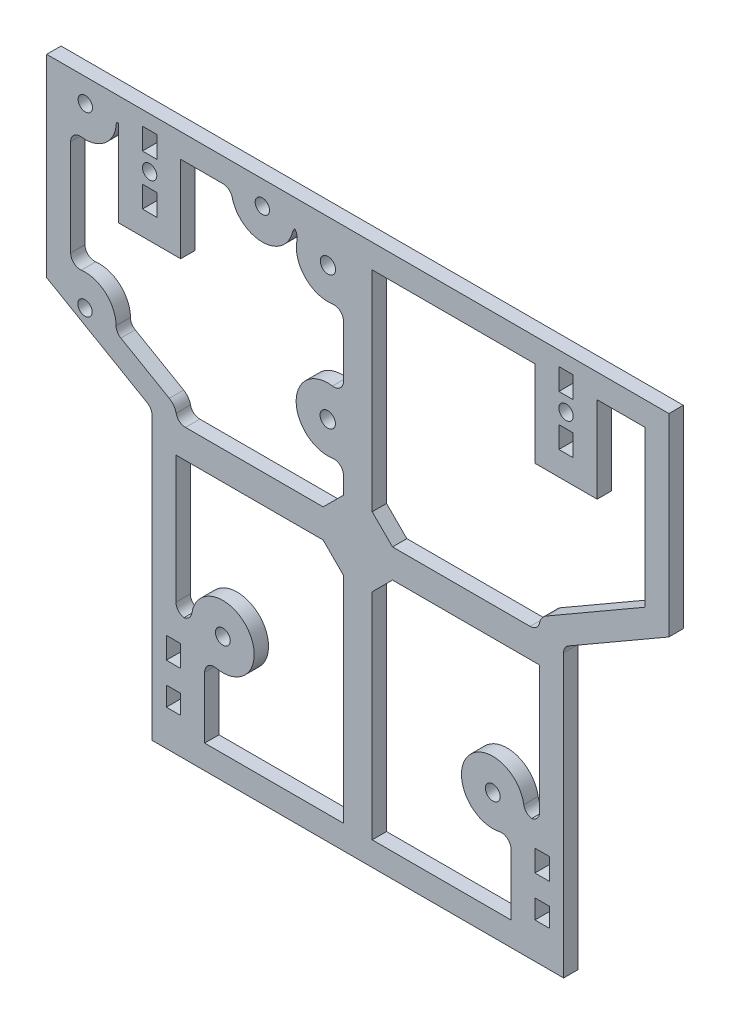
from build123d import *

# Parameters (mm, degrees)
CROQUIS1_W                 = 130
CROQUIS1_H                 = 113.129079584
CROQUIS1_W_2               = 3
CROQUIS1_H_2               = 1.5
CROQUIS1_H_3               = 4.5
SALIENTE_EXTRUIR1_DEPTH    = 3
CORTAR_EXTRUIR1_DEPTH      = 3
CROQUIS7_R                 = 1.55
CROQUIS7_R_2               = 1.6
CROQUIS7_R_3               = 1.5
CORTAR_EXTRUIR3_DEPTH      = 10
CORTAR_EXTRUIR4_DEPTH      = 10
CROQUIS9_W                 = 3
CROQUIS9_H                 = 4
CORTAR_EXTRUIR5_DEPTH      = 10
CORTAR_EXTRUIR6_DEPTH      = 87.58316764
CORTAR_EXTRUIR6_DEPTH_BACK = 87.58316764
CROQUIS10_R                = 1.5
REDONDEO1_R                = 2
REDONDEO2_R                = 3


with BuildPart() as part:
    # Croquis1 → Saliente-Extruir1 (new body)
    with BuildSketch(Plane.XY):
        with Locations((0, -0.555027071)):
            Rectangle(CROQUIS1_W, CROQUIS1_H)
        with Locations((38.5, -46.369566863)):
            Rectangle(CROQUIS1_W_2, CROQUIS1_H_2, mode=Mode.SUBTRACT)
        with Locations((-38.5, -46.369566863)):
            Rectangle(CROQUIS1_W_2, CROQUIS1_H_2, mode=Mode.SUBTRACT)
        with Locations((38.5, -38.869566863)):
            Rectangle(CROQUIS1_W_2, CROQUIS1_H_3, mode=Mode.SUBTRACT)
        with Locations((-38.5, -38.869566863)):
            Rectangle(CROQUIS1_W_2, CROQUIS1_H_3, mode=Mode.SUBTRACT)
        with Locations((43.5, 40.259512721)):
            Rectangle(CROQUIS1_W_2, CROQUIS1_H_3, mode=Mode.SUBTRACT)
        with Locations((43.5, 50.759512721)):
            Rectangle(CROQUIS1_W_2, CROQUIS1_H_3, mode=Mode.SUBTRACT)
        with Locations((-43.5, 40.259512721)):
            Rectangle(CROQUIS1_W_2, CROQUIS1_H_3, mode=Mode.SUBTRACT)
        with Locations((-43.5, 50.759512721)):
            Rectangle(CROQUIS1_W_2, CROQUIS1_H_3, mode=Mode.SUBTRACT)
    extrude(amount=SALIENTE_EXTRUIR1_DEPTH)

    # Croquis2 → Cortar-Extruir1 (cut)
    with BuildSketch(Plane.XY):
        Polygon((-43, -57.119566863), (-43, 2.880433137), (-65, 15.582139059), (-65, -57.119566863), align=None)
    cortar_extruir1 = extrude(amount=CORTAR_EXTRUIR1_DEPTH, mode=Mode.SUBTRACT)

    # Simetría1: Cortar-Extruir1 across plane
    add(cortar_extruir1.mirror(Plane(origin=(0, 0, 0), x_dir=(0, 0, 1), z_dir=(1, 0, 0))), mode=Mode.SUBTRACT)

    # Croquis7 → Cortar-Extruir3 (cut)
    with BuildSketch(Plane.XY):
        with Locations((-28.2, -30.943433351)):
            Circle(CROQUIS7_R)
        with Locations((28.2, -30.943433351)):
            Circle(CROQUIS7_R)
        with Locations((-6.242176561, 47.210601794)):
            Circle(CROQUIS7_R_2)
        with Locations((-6.287991701, 19.310639411)):
            Circle(CROQUIS7_R_2)
        with Locations((-57.003272906, 14.118912973)):
            Circle(CROQUIS7_R_3)
        with Locations((-19.942564364, 51.058104658)):
            Circle(CROQUIS7_R_3)
        with Locations((-56.942514477, 51.118863087)):
            Circle(CROQUIS7_R_3)
    extrude(amount=CORTAR_EXTRUIR3_DEPTH, mode=Mode.SUBTRACT)

    # Croquis8 → Cortar-Extruir4 (cut)
    with BuildSketch(Plane.XY):
        Polygon((37, 33.009512721), (37, 51.009512721), (3, 51.009512721), (3, 7.242640687), (7.242640687, 3), (38, 3), (38, 5.767184483), (60, 18.468890405), (60, 51.009512721), (50, 51.009512721), (50, 33.009512721), align=None)
        with BuildLine():
            Line((-7.242640687, 3), (-3, 7.242640687))
            Line((-3, 7.242640687), (-3, 13.58795555))
            ThreePointArc((-3, 13.58795555), (-12.887991701, 19.310639411), (-3, 25.033323272))
            Line((-3, 25.033323272), (-3, 41.461837479))
            ThreePointArc((-3, 41.461837479), (-11.136091988, 42.782329919), (-11.639238333, 51.009512721))
            Line((-11.639238333, 51.009512721), (-13.442745995, 51.009512721))
            ThreePointArc((-13.442745995, 51.009512721), (-19.942564364, 44.558104658), (-26.442382732, 51.009512721))
            Line((-26.442382732, 51.009512721), (-37, 51.009512721))
            Line((-37, 51.009512721), (-37, 33.009512721))
            Line((-37, 33.009512721), (-50, 33.009512721))
            Line((-50, 33.009512721), (-50, 51.009512721))
            Line((-50, 51.009512721), (-50.44343435, 51.009512721))
            ThreePointArc((-50.44343435, 51.009512721), (-53.644642278, 45.517609749), (-60, 45.382855566))
            Line((-60, 45.382855566), (-60, 19.886895872))
            ThreePointArc((-60, 19.886895872), (-53.177308637, 19.373624897), (-50.59374625, 13.03818727))
            Line((-50.59374625, 13.03818727), (-38, 5.767184483))
            Line((-38, 5.767184483), (-38, 3))
            Line((-38, 3), (-7.242640687, 3))
        make_face()
        with BuildLine():
            Line((38, -3), (7.242640687, -3))
            Line((7.242640687, -3), (3, -7.242640687))
            Line((3, -7.242640687), (3, -52.119566863))
            Line((3, -52.119566863), (32, -52.119566863))
            Line((32, -52.119566863), (32, -36.278459124))
            ThreePointArc((32, -36.278459124), (22.540832887, -27.64550558), (34.715009092, -31.619566863))
            Line((34.715009092, -31.619566863), (38, -31.619566863))
            Line((38, -31.619566863), (38, -3))
        make_face()
        with BuildLine():
            Line((-3, -7.242640687), (-7.242640687, -3))
            Line((-7.242640687, -3), (-38, -3))
            Line((-38, -3), (-38, -31.619566863))
            Line((-38, -31.619566863), (-34.715009092, -31.619566863))
            ThreePointArc((-34.715009092, -31.619566863), (-22.540832887, -27.64550558), (-32, -36.278459124))
            Line((-32, -36.278459124), (-32, -52.119566863))
            Line((-32, -52.119566863), (-3, -52.119566863))
            Line((-3, -52.119566863), (-3, -7.242640687))
        make_face()
    extrude(amount=CORTAR_EXTRUIR4_DEPTH, mode=Mode.SUBTRACT)

    # Croquis9 → Cortar-Extruir5 (cut)
    with BuildSketch(Plane.XY):
        with Locations((-38.5, -47.619566863)):
            Rectangle(CROQUIS9_W, CROQUIS9_H)
        with Locations((38.5, -47.619566863)):
            Rectangle(CROQUIS9_W, CROQUIS9_H)
    extrude(amount=CORTAR_EXTRUIR5_DEPTH, mode=Mode.SUBTRACT)

    # Croquis10 → Cortar-Extruir6 (cut, two sides: drawn at the far end of the back side and taken through both)
    with BuildSketch(Plane.XY.offset(-CORTAR_EXTRUIR6_DEPTH_BACK)):
        with Locations((43.5, 45.509512721)):
            Circle(CROQUIS10_R)
        with Locations((-43.5, 45.509512721)):
            Circle(CROQUIS10_R)
    extrude(amount=CORTAR_EXTRUIR6_DEPTH + CORTAR_EXTRUIR6_DEPTH_BACK, mode=Mode.SUBTRACT)

    # Redondeo1
    # the kernel refuses this fillet: 2 mm, written as the material it adds along each edge
    with BuildSketch(Plane(origin=(32, -36.278459124, 0), x_dir=(-0.9149086715466047, -0.40366090066889926, 0), z_dir=(0, 0, 1))) as redondeo1_piece_1:
        with BuildLine():
            CenterArc((3.050226842, 1.95877031), REDONDEO1_R, 156.192760529, 102.153197469)
            Line((1.220409498, 2.766092111), (0, 0))
            ThreePointArc((0, 0), (1.323111643, 0.135027235), (2.646223286, 0))
        make_face()
    extrude(amount=3)
    with BuildSketch(Plane(origin=(38, -31.619566863, 0), x_dir=(-1, 0, 0), z_dir=(0, 0, 1)), Plane(origin=(-38, -31.619566863, 0), x_dir=(0, 1, 0), z_dir=(0, 0, 1)), Plane(origin=(-38, 3, 0), x_dir=(0, 1, 0), z_dir=(0, 0, 1))) as redondeo1_piece_2:
        with BuildLine():
            CenterArc((REDONDEO1_R, -REDONDEO1_R), REDONDEO1_R, 90, 90)
            Line((0, -REDONDEO1_R), (0, 0))
            Line((0, 0), (REDONDEO1_R, 0))
        make_face()
    extrude(amount=3)
    with BuildSketch(Plane(origin=(34.715009092, -31.619566863, 0), x_dir=(-0.02602354238357217, 0.999661330272313, 0), z_dir=(0, 0, 1))) as redondeo1_piece_3:
        with BuildLine():
            CenterArc((1.949048389, -1.983269394), REDONDEO1_R, 97.416204182, 81.092588325)
            Line((-0.050274272, -1.93122231), (0, 0))
            ThreePointArc((0, 0), (0.845448142, -0.054792733), (1.690896284, 0))
        make_face()
    extrude(amount=3)
    with BuildSketch(Plane(origin=(-32, -36.278459124, 0), x_dir=(0, -1, 0), z_dir=(0, 0, 1))) as redondeo1_piece_4:
        with BuildLine():
            CenterArc((3.023353256, 2), REDONDEO1_R, 167.846802531, 102.153197469)
            ThreePointArc((1.068176875, 2.421052632), (0.657626025, 1.156021101), (0, 0))
            Line((0, 0), (3.023353256, 0))
        make_face()
    extrude(amount=3)
    with BuildSketch(Plane(origin=(-34.715009092, -31.619566863, 0), x_dir=(0.026023542383658504, 0.9996613302723107, 0), z_dir=(0, 0, 1))) as redondeo1_piece_5:
        with BuildLine():
            CenterArc((1.949048389, 1.983269394), REDONDEO1_R, 181.491207493, 81.092588325)
            Line((-0.050274272, 1.93122231), (0, 0))
            ThreePointArc((0, 0), (0.845448142, 0.054792733), (1.690896284, 0))
        make_face()
    extrude(amount=3)
    with BuildSketch(Plane(origin=(-43, 2.880433137, 0), x_dir=(-0.866025403784439, 0.49999999999999933, 0), z_dir=(0, 0, 1))) as redondeo1_piece_6:
        with BuildLine():
            CenterArc((REDONDEO1_R * 0.57735026919, REDONDEO1_R), REDONDEO1_R, 210, 60)
            Line((-REDONDEO1_R * 0.288675134595, REDONDEO1_R * 0.5), (0, 0))
            Line((0, 0), (REDONDEO1_R * 0.57735026919, 0))
        make_face()
    extrude(amount=3)
    with BuildSketch(Plane(origin=(43, 2.880433137, 0), x_dir=(0.866025403784439, 0.49999999999999933, 0), z_dir=(0, 0, 1))) as redondeo1_piece_7:
        with BuildLine():
            CenterArc((REDONDEO1_R * 0.57735026919, -REDONDEO1_R), REDONDEO1_R, 90, 60)
            Line((-REDONDEO1_R * 0.288675134595, -REDONDEO1_R * 0.5), (0, 0))
            Line((0, 0), (REDONDEO1_R * 0.57735026919, 0))
        make_face()
    extrude(amount=3)
    with BuildSketch(Plane(origin=(38, 3, 0), x_dir=(0, 1, 0), z_dir=(0, 0, 1))) as redondeo1_piece_8:
        with BuildLine():
            CenterArc((REDONDEO1_R, REDONDEO1_R), REDONDEO1_R, 180, 90)
            Line((0, REDONDEO1_R), (0, 0))
            Line((0, 0), (REDONDEO1_R, 0))
        make_face()
    extrude(amount=3)
    with BuildSketch(Plane(origin=(-3, 13.58795555, 0), x_dir=(0, -1, 0), z_dir=(0, 0, 1))) as redondeo1_piece_9:
        with BuildLine():
            CenterArc((2.78032016, -2), REDONDEO1_R, 90, 98.613393798)
            ThreePointArc((0.802877364, -2.299532954), (0.508434809, -1.112408992), (0, 0))
            Line((0, 0), (2.78032016, 0))
        make_face()
    extrude(amount=3)
    with BuildSketch(Plane(origin=(-3, 41.461837479, 0), x_dir=(0, -1, 0), z_dir=(0, 0, 1))) as redondeo1_piece_10:
        with BuildLine():
            CenterArc((2.761053391, -2), REDONDEO1_R, 90, 98.304802099)
            ThreePointArc((0.782026018, -2.28887827), (0.496762606, -1.108308364), (0, 0))
            Line((0, 0), (2.761053391, 0))
        make_face()
    extrude(amount=3)
    with BuildSketch(Plane(origin=(-60, 45.382855566, 0), x_dir=(0, -1, 0), z_dir=(0, 0, 1))) as redondeo1_piece_11:
        with BuildLine():
            CenterArc((2.697955034, 2), REDONDEO1_R, 172.853311138, 97.146688862)
            ThreePointArc((0.713493256, 2.248820123), (0.459632164, 1.091767106), (0, 0))
            Line((0, 0), (2.697955034, 0))
        make_face()
    extrude(amount=3)
    with BuildSketch(Plane(origin=(-26.442382732, 51.009512721, 0), x_dir=(-1, 0, 0), z_dir=(0, 0, 1))) as redondeo1_piece_12:
        with BuildLine():
            CenterArc((1.749622284, 2), REDONDEO1_R, 193.946207215, 76.053792785)
            ThreePointArc((-0.191422576, 1.517978368), (-0.05089194, 0.764641066), (0, 0))
            Line((0, 0), (1.749622284, 0))
        make_face()
    extrude(amount=3)
    with BuildSketch(Plane(origin=(-13.442745995, 51.009512721, 0), x_dir=(-0.12511276967774176, -0.9921425274946963, 0), z_dir=(0, 0, 1))) as redondeo1_piece_13:
        with BuildLine():
            CenterArc((1.765384965, 1.986100214), REDONDEO1_R, 187.187268132, 76.053792785)
            Line((-0.21890009, 1.735874675), (0, 0))
            ThreePointArc((0, 0), (0.765000152, 0.045174304), (1.530000303, 0))
        make_face()
    extrude(amount=3)
    with BuildSketch(Plane(origin=(-11.639238333, 51.009512721, 0), x_dir=(-0.40047050280585245, -0.916309650927255, 0), z_dir=(0, 0, 1))) as redondeo1_piece_14:
        with BuildLine():
            CenterArc((3.039112653, -1.959615623), REDONDEO1_R, 101.533545262, 102.074049912)
            Line((1.206493351, -2.760556629), (0, 0))
            ThreePointArc((0, 0), (1.319614704, -0.133268443), (2.639229409, 0))
        make_face()
    extrude(amount=3)
    with BuildSketch(Plane(origin=(-3, 25.033323272, 0), x_dir=(-0.9441088893447234, 0.329633743813149, 0), z_dir=(0, 0, 1))) as redondeo1_piece_15:
        with BuildLine():
            CenterArc((2.804705122, -1.96565749), REDONDEO1_R, 100.633152949, 98.613393798)
            Line((0.916487343, -2.624924978), (0, 0))
            ThreePointArc((0, 0), (1.217832487, -0.113330282), (2.435664974, 0))
        make_face()
    extrude(amount=3)
    with BuildSketch(Plane(origin=(-60, 19.886895872, 0), x_dir=(0.9558237450549008, 0.29394041639288776, 0), z_dir=(0, 0, 1))) as redondeo1_piece_16:
        with BuildLine():
            CenterArc((2.697460658, 1.967395146), REDONDEO1_R, 162.905989019, 96.734111648)
            Line((0.785813168, 2.555275979), (0, 0))
            ThreePointArc((0, 0), (1.168899619, 0.105965774), (2.337799237, 0))
        make_face()
    extrude(amount=3)
    with BuildSketch(Plane(origin=(-50.59374625, 13.03818727, 0), x_dir=(0.08214816682201194, 0.996620127575087, 0), z_dir=(0, 0, 1))) as redondeo1_piece_17:
        with BuildLine():
            CenterArc((1.270481822, -1.992813203), REDONDEO1_R, 94.858704239, 59.853348925)
            Line((-0.537863042, -1.138477874), (0, 0))
            ThreePointArc((0, 0), (0.550542123, -0.023357091), (1.101084246, 0))
        make_face()
    extrude(amount=3)

    # Redondeo2
    redondeo2_edges = [part.edges().sort_by_distance(p)[0] for p in [
        (-38, 5.767184483, 1.5),
        (38, 5.767184483, 1.5),
    ]]
    fillet(redondeo2_edges, radius=REDONDEO2_R)


solid = part.part
